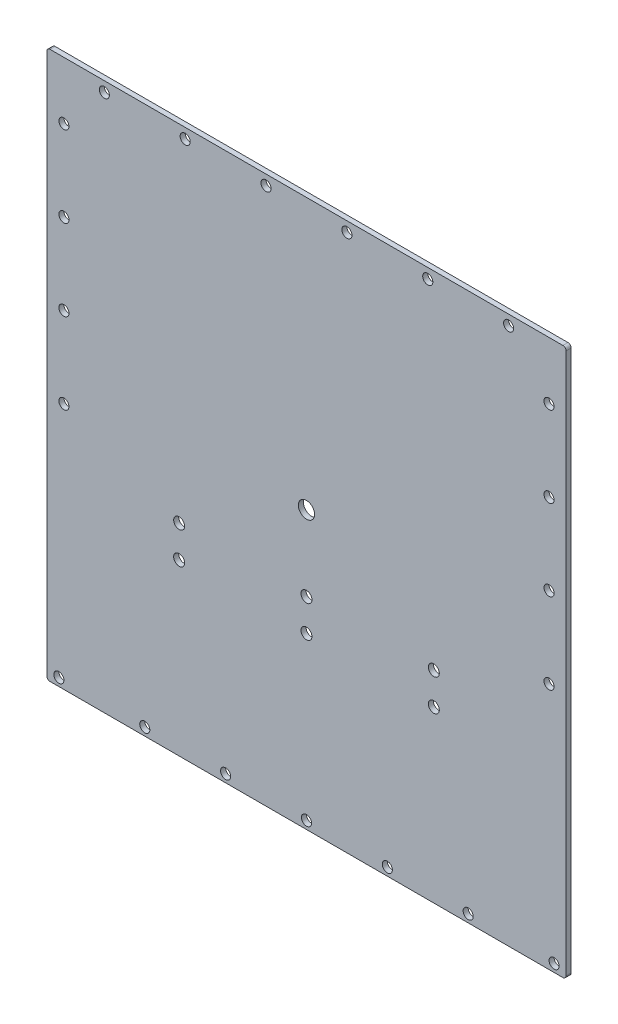
from build123d import *

# Parameters (mm, degrees)
SKETCH2_W               = 163.1
SKETCH2_H               = 171.98
SKETCH2_R               = 1.5875
SKETCH2_R_2             = 2.5527
BOSS_EXTRUDE2_DEPTH     = 1.5875
FILLET1_R               = 1
CUT_EXTRUDE1_DEPTH      = 238.715061694
CUT_EXTRUDE1_DEPTH_BACK = 238.715061694
SKETCH3_R               = 1.725


with BuildPart() as part:
    # Sketch2 → Boss-Extrude2 (new body)
    with BuildSketch(Plane.XY):
        with Locations((82.55, -85.99)):
            Rectangle(SKETCH2_W, SKETCH2_H)
        with Locations((4.7625, -169.48)):
            Circle(SKETCH2_R, mode=Mode.SUBTRACT)
        with Locations((31.75, -169.48)):
            Circle(SKETCH2_R, mode=Mode.SUBTRACT)
        with Locations((57.15, -169.48)):
            Circle(SKETCH2_R, mode=Mode.SUBTRACT)
        with Locations((6.35, -94.25)):
            Circle(SKETCH2_R, mode=Mode.SUBTRACT)
        with Locations((82.55, -169.48)):
            Circle(SKETCH2_R, mode=Mode.SUBTRACT)
        with Locations((107.95, -169.48)):
            Circle(SKETCH2_R, mode=Mode.SUBTRACT)
        with Locations((133.35, -169.48)):
            Circle(SKETCH2_R, mode=Mode.SUBTRACT)
        with Locations((160.3375, -169.48)):
            Circle(SKETCH2_R, mode=Mode.SUBTRACT)
        with Locations((158.75, -94.25)):
            Circle(SKETCH2_R, mode=Mode.SUBTRACT)
        with Locations((6.35, -68.85)):
            Circle(SKETCH2_R, mode=Mode.SUBTRACT)
        with Locations((6.35, -43.45)):
            Circle(SKETCH2_R, mode=Mode.SUBTRACT)
        with Locations((6.35, -18.05)):
            Circle(SKETCH2_R, mode=Mode.SUBTRACT)
        with Locations((19.05, -3.175)):
            Circle(SKETCH2_R, mode=Mode.SUBTRACT)
        with Locations((44.45, -3.175)):
            Circle(SKETCH2_R, mode=Mode.SUBTRACT)
        with Locations((69.85, -3.175)):
            Circle(SKETCH2_R, mode=Mode.SUBTRACT)
        with Locations((82.55, -85)):
            Circle(SKETCH2_R_2, mode=Mode.SUBTRACT)
        with Locations((158.75, -68.85)):
            Circle(SKETCH2_R, mode=Mode.SUBTRACT)
        with Locations((95.25, -3.175)):
            Circle(SKETCH2_R, mode=Mode.SUBTRACT)
        with Locations((120.65, -3.175)):
            Circle(SKETCH2_R, mode=Mode.SUBTRACT)
        with Locations((158.75, -43.45)):
            Circle(SKETCH2_R, mode=Mode.SUBTRACT)
        with Locations((158.75, -18.05)):
            Circle(SKETCH2_R, mode=Mode.SUBTRACT)
        with Locations((146.05, -3.175)):
            Circle(SKETCH2_R, mode=Mode.SUBTRACT)
    extrude(amount=BOSS_EXTRUDE2_DEPTH)

    # Fillet1
    fillet1_edges = [part.edges().sort_by_distance(p)[0] for p in [
        (1, -171.98, 0.79375),
        (1, 0, 0.79375),
        (164.1, 0, 0.79375),
        (164.1, -171.98, 0.79375),
    ]]
    fillet(fillet1_edges, radius=FILLET1_R)

    # Sketch3 → Cut-Extrude1 (cut, two sides: drawn at the far end of the back side and taken through both)
    with BuildSketch(Plane.XY.offset(1.5875).offset(-CUT_EXTRUDE1_DEPTH_BACK)):
        with Locations((42.55, -108.63038)):
            Circle(SKETCH3_R)
        with Locations((82.55, -108.63038)):
            Circle(SKETCH3_R)
        with Locations((122.55, -108.63038)):
            Circle(SKETCH3_R)
        with Locations((42.55, -118.63038)):
            Circle(SKETCH3_R)
        with Locations((82.55, -118.63038)):
            Circle(SKETCH3_R)
        with Locations((122.55, -118.63038)):
            Circle(SKETCH3_R)
    extrude(amount=CUT_EXTRUDE1_DEPTH + CUT_EXTRUDE1_DEPTH_BACK, mode=Mode.SUBTRACT)


solid = part.part
